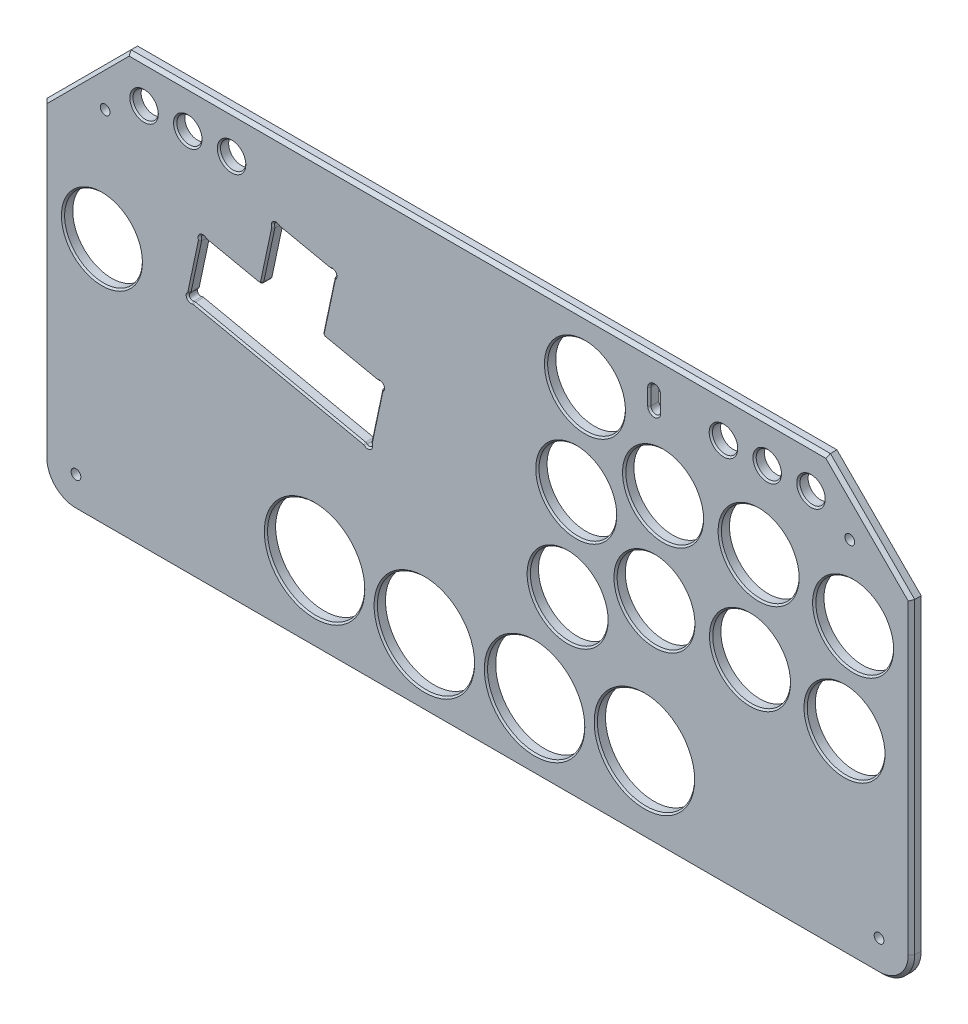
from build123d import *

# Parameters (mm, degrees)
BOSS_EXTRUDE1_DEPTH   = 3
SKETCH24_R            = 3.9
CUT_EXTRUDE2_DEPTH    = 307.167536128
SKETCH1_R             = 12
SKETCH1_R_2           = 15
CUT_EXTRUDE3_DEPTH    = 307.167536128
CUT_EXTRUDE5_DEPTH    = 326.804403089
CUT_EXTRUDE6_DEPTH    = 307.167536128
F_3_0MM_DOWEL_HOLE1_D = 3
FILLET1_R             = 1
CHAMFER1_SIZE         = 1
CHAMFER2_SIZE         = 0.5


with BuildPart() as part:
    # Sketch2 → Boss-Extrude1 (new body)
    with BuildSketch(Plane.XY):
        with BuildLine():
            Line((6.41186441, 110.238694526), (6.41186441, 15.286374556))
            ThreePointArc((6.41186441, 15.286374556), (9.340796598, 8.215306744), (16.41186441, 5.286374556))
            Line((16.41186441, 5.286374556), (264.168886442, 5.286374556))
            ThreePointArc((264.168886442, 5.286374556), (271.239954254, 8.215306744), (274.168886442, 15.286374556))
            Line((274.168886442, 15.286374556), (274.168886442, 110.238694526))
            Line((274.168886442, 110.238694526), (248.168886442, 136.238694526))
            Line((248.168886442, 136.238694526), (32.41186441, 136.238694526))
            Line((32.41186441, 136.238694526), (6.41186441, 110.238694526))
        make_face()
    extrude(amount=-BOSS_EXTRUDE1_DEPTH)

    # Sketch24 → Cut-Extrude2 (cut, through all)
    with BuildSketch(Plane.XY):
        with Locations((37.41186441, 124.238694526)):
            Circle(SKETCH24_R)
        with Locations((50.91186441, 124.238694526)):
            Circle(SKETCH24_R)
        with Locations((64.41186441, 124.238694526)):
            Circle(SKETCH24_R)
        with Locations((216.168886442, 124.238694526)):
            Circle(SKETCH24_R)
        with Locations((229.668886442, 124.238694526)):
            Circle(SKETCH24_R)
        with Locations((243.168886442, 124.238694526)):
            Circle(SKETCH24_R)
        with BuildLine():
            Line((193.298949614, 126.738694526), (193.298949614, 121.738694526))
            ThreePointArc((193.298949614, 121.738694526), (194.798949614, 120.238694526), (196.298949614, 121.738694526))
            Line((196.298949614, 121.738694526), (196.298949614, 126.738694526))
            ThreePointArc((196.298949614, 126.738694526), (194.798949614, 128.238694526), (193.298949614, 126.738694526))
        make_face()
    extrude(amount=-CUT_EXTRUDE2_DEPTH, mode=Mode.SUBTRACT)

    # Sketch1 → Cut-Extrude3 (cut, through all)
    with BuildSketch(Plane.XY):
        with Locations((24.41186441, 82.179064133)):
            Circle(SKETCH1_R)
        with Locations((168.091946024, 58.360067852)):
            Circle(SKETCH1_R)
        with Locations((194.873540874, 70.729230202)):
            Circle(SKETCH1_R)
        with Locations((224.358659158, 69.792320505)):
            Circle(SKETCH1_R)
        with Locations((253.510608286, 65.274150291)):
            Circle(SKETCH1_R)
        with Locations((256.168886442, 94.654135948)):
            Circle(SKETCH1_R)
        with Locations((227.016937315, 99.172306162)):
            Circle(SKETCH1_R)
        with Locations((197.531819031, 100.10921586)):
            Circle(SKETCH1_R)
        with Locations((170.75022418, 87.740053509)):
            Circle(SKETCH1_R)
        with Locations((191.774681199, 29.091460603)):
            Circle(SKETCH1_R_2)
        with Locations((157.891946024, 26.270067852)):
            Circle(SKETCH1_R_2)
        with Locations((123.891946024, 26.270067852)):
            Circle(SKETCH1_R_2)
        with Locations((90.009210849, 29.091460603)):
            Circle(SKETCH1_R_2)
        with Locations((173.429012786, 117.118176179)):
            Circle(SKETCH1_R)
    extrude(amount=-CUT_EXTRUDE3_DEPTH, mode=Mode.SUBTRACT)

    # Sketch4 → Cut-Extrude5 (cut, through all)
    with BuildSketch(Plane(origin=(-30.20834345, 20.07496957, 0), x_dir=(0.9781476007338056, -0.2079116908177598, 0), z_dir=(0, 0, 1))):
        Polygon((86.170570415, 113.241725336), (86.170570415, 94.191725336), (67.120570415, 94.191725336), (67.120570415, 75.141725336), (124.270570415, 75.141725336), (124.270570415, 94.191725336), (105.220570415, 94.191725336), (105.220570415, 113.241725336), align=None)
    extrude(amount=-CUT_EXTRUDE5_DEPTH, mode=Mode.SUBTRACT)

    # Sketch27 → Cut-Extrude6 (cut, through all)
    with BuildSketch(Plane.XY):
        with BuildLine():
            Line((54.735010804, 96.86991883), (56.41235194, 97.9591969))
            ThreePointArc((56.41235194, 97.9591969), (55.029042337, 98.253228433), (54.735010804, 96.86991883))
        make_face()
        with BuildLine():
            Line((51.36235616, 81.002826242), (52.45163423, 79.325485106))
            ThreePointArc((52.45163423, 79.325485106), (51.068324627, 79.619516639), (51.36235616, 81.002826242))
        make_face()
        with BuildLine():
            Line((105.586150406, 68.031395041), (107.263491542, 69.120673111))
            ThreePointArc((107.263491542, 69.120673111), (106.969460009, 67.737363508), (105.586150406, 68.031395041))
        make_face()
        with BuildLine():
            Line((109.546868116, 86.665106835), (110.636146186, 84.987765699))
            ThreePointArc((110.636146186, 84.987765699), (110.930177719, 86.371075302), (109.546868116, 86.665106835))
        make_face()
        with BuildLine():
            Line((77.329440308, 111.542912914), (79.006781444, 112.632190984))
            ThreePointArc((79.006781444, 112.632190984), (77.623471841, 112.926222516), (77.329440308, 111.542912914))
        make_face()
        with BuildLine():
            Line((94.873874032, 109.259536339), (95.963152102, 107.582195203))
            ThreePointArc((95.963152102, 107.582195203), (96.257183635, 108.965504806), (94.873874032, 109.259536339))
        make_face()
    extrude(amount=-CUT_EXTRUDE6_DEPTH, mode=Mode.SUBTRACT)

    # Ø3.0mm Dowel Hole1 (through all)
    with Locations(Plane.XY):
        with Locations((25.42227205, 117.228286886), (16.41186441, 15.286374556), (264.168886442, 15.286374556), (255.158478802, 117.228286886)):
            Hole(F_3_0MM_DOWEL_HOLE1_D / 2)

    # Fillet1
    fillet1_edges = [part.edges().sort_by_distance(p)[0] for p in [
        (105.586150406, 68.031395041, -1.5),
        (107.263491542, 69.120673111, -1.5),
        (110.636146186, 84.987765699, -1.5),
        (109.546868116, 86.665106835, -1.5),
        (92.296465925, 90.331793012, -1.5),
        (95.963152102, 107.582195203, -1.5),
        (94.873874032, 109.259536339, -1.5),
        (77.329440308, 111.542912914, -1.5),
        (79.006781444, 112.632190984, -1.5),
        (73.662754131, 94.292510723, -1.5),
        (52.45163423, 79.325485106, -1.5),
        (51.36235616, 81.002826242, -1.5),
        (54.735010804, 96.86991883, -1.5),
        (56.41235194, 97.9591969, -1.5),
    ]]
    fillet(fillet1_edges, radius=FILLET1_R)

    # Chamfer1
    chamfer1_edges = [part.edges().sort_by_distance(p)[0] for p in [
        (274.168886442, 62.762534541, 0),
        (271.239954254, 8.215306744, 0),
        (140.290375426, 5.286374556, 0),
        (9.340796598, 8.215306744, 0),
        (261.168886442, 123.238694526, 0),
        (140.290375426, 136.238694526, 0),
        (6.41186441, 62.762534541, 0),
        (19.41186441, 123.238694526, 0),
    ]]
    chamfer(chamfer1_edges, length=CHAMFER1_SIZE)

    # Chamfer2
    chamfer2_edges = [part.edges().sort_by_distance(p)[0] for p in [
        (239.268886442, 124.238694526, 0),
        (225.768886442, 124.238694526, 0),
        (212.268886442, 124.238694526, 0),
        (193.298949614, 124.238694526, 0),
        (194.798949614, 120.238694526, 0),
        (194.798949614, 128.238694526, 0),
        (196.298949614, 124.238694526, 0),
        (60.51186441, 124.238694526, 0),
        (47.01186441, 124.238694526, 0),
        (33.51186441, 124.238694526, 0),
        (161.429012786, 117.118176179, 0),
        (244.168886442, 94.654135948, 0),
        (215.016937315, 99.172306162, 0),
        (185.531819031, 100.10921586, 0),
        (158.75022418, 87.740053509, 0),
        (182.873540874, 70.729230202, 0),
        (212.358659158, 69.792320505, 0),
        (241.510608286, 65.274150291, 0),
        (176.774681199, 29.091460603, 0),
        (156.091946024, 58.360067852, 0),
        (142.891946024, 26.270067852, 0),
        (108.891946024, 26.270067852, 0),
        (75.009210849, 29.091460603, 0),
        (12.41186441, 82.179064133, 0),
        (86.940327738, 110.945863661, 0),
        (79.077438822, 112.655313348, 0),
        (94.818730018, 109.309398615, 0),
        (77.623471841, 112.926222516, 0),
        (96.257183635, 108.965504806, 0),
        (77.279578032, 111.487768899, 0),
        (95.986274466, 107.511537825, 0),
        (75.565237838, 103.242992853, 0),
        (94.198949632, 99.282275143, 0),
        (73.437157256, 94.639899446, 0),
        (92.643854649, 90.557389887, 0),
        (64.712272, 96.19499443, 0),
        (101.246948056, 88.429309305, 0),
        (56.483009318, 97.982319264, 0),
        (109.491724102, 86.714969111, 0),
        (55.029042337, 98.253228433, 0),
        (110.930177719, 86.371075302, 0),
        (54.685148528, 96.814774815, 0),
        (110.65926855, 84.917108321, 0),
        (53.048683482, 88.936372536, 0),
        (108.949818864, 77.054219405, 0),
        (51.339233796, 81.07348362, 0),
        (107.313353817, 69.175817126, 0),
        (51.068324627, 79.619516639, 0),
        (106.969460009, 67.737363508, 0),
        (52.506778244, 79.27562283, 0),
        (105.515493027, 68.008272677, 0),
        (79.018892318, 73.678440073, 0),
    ]]
    chamfer(chamfer2_edges, length=CHAMFER2_SIZE)


solid = part.part
